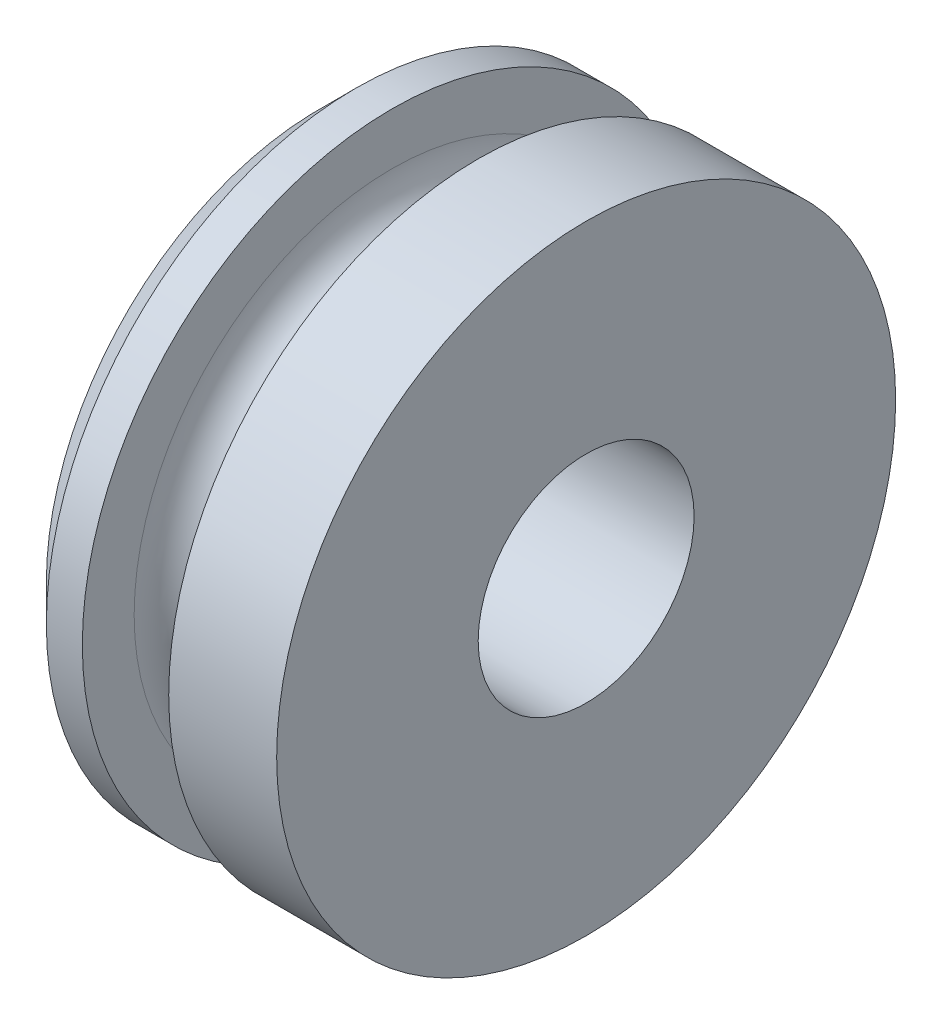
from build123d import *

# Parameters (mm, degrees)
CHAMFER1_SIZE = 3.175


with BuildPart() as part:
    # Sketch1 → Revolve1 (revolve)
    with BuildSketch(Plane.XY):
        with BuildLine():
            Line((0, 27.305), (0, 9.525))
            Line((0, 9.525), (23.495, 9.525))
            Line((23.495, 9.525), (23.495, 27.305))
            Line((23.495, 27.305), (13.97, 27.305))
            Line((13.97, 27.305), (13.97, 22.733))
            ThreePointArc((13.97, 22.733), (10.16, 18.923), (6.35, 22.733))
            Line((6.35, 22.733), (6.35, 27.305))
            Line((6.35, 27.305), (0, 27.305))
        make_face()
    revolve(axis=Axis((0, 0, 0), (1, 0, 0)))

    # Chamfer1
    chamfer1_edges = [part.edges().sort_by_distance(p)[0] for p in [
        (0, -27.305, 0),
    ]]
    chamfer(chamfer1_edges, length=CHAMFER1_SIZE)


solid = part.part
